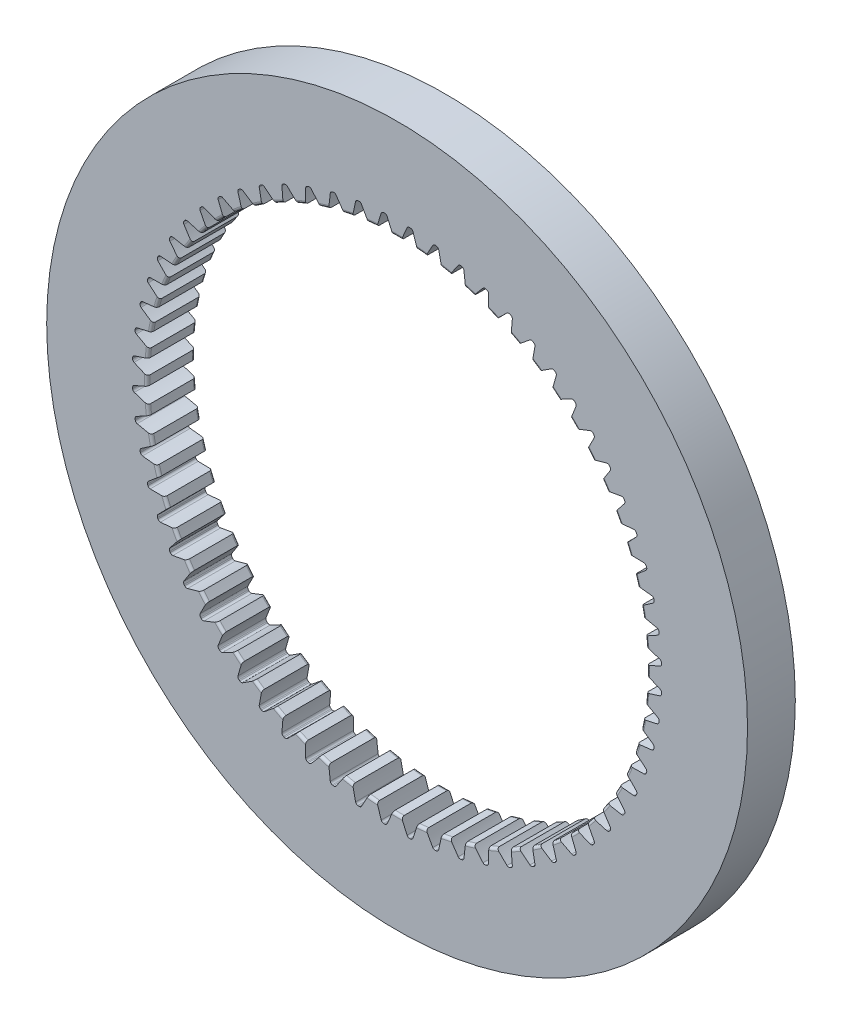
from build123d import *

# Parameters (mm, degrees)
BOSS_EXTRUDE1_DEPTH      = 2.38125
BOSS_EXTRUDE1_DEPTH_BACK = 2.38125
SKETCH3_R                = 34.925
SKETCH3_R_2              = 24.9047
FILLET1_R                = 0.266307122
CUT_EXTRUDE1_DEPTH       = 50.448777554
FILLET2_R                = 0.266307122
CIRPATTERN1_COUNT        = 64
FILLET2_OF_CIRPATTERN1_R = 0.266307122


with BuildPart() as part:
    # Sketch3 → Boss-Extrude1 (new, two sides: drawn at the far end of the back side and taken through both)
    with BuildSketch(Plane.XY.offset(-BOSS_EXTRUDE1_DEPTH_BACK)):
        Circle(SKETCH3_R)
        Circle(SKETCH3_R_2, mode=Mode.SUBTRACT)
    extrude(amount=BOSS_EXTRUDE1_DEPTH + BOSS_EXTRUDE1_DEPTH_BACK)

    # Fillet1
    fillet1_edges = [part.edges().sort_by_distance(p)[0] for p in [
        (-24.9047, 0, -2.38125),
        (-24.9047, 0, 2.38125),
    ]]
    fillet(fillet1_edges, radius=FILLET1_R)

    # Sketch4 → Cut-Extrude1 (cut, symmetric)
    with BuildSketch(Plane.XY):
        with BuildLine():
            ThreePointArc((26.370416202, -1.071779071), (26.360396954, -1.295003261), (26.34848816, -1.518134624))
            add(Edge.make_bspline(
                [(23.774707909, -2.110421825), (23.778625308, -2.110730183), (23.789623201, -2.111474), (23.810456777, -2.11240213), (23.844509879, -2.113237254), (23.887982397, -2.11330223), (23.944264107, -2.112238179), (24.01068022, -2.109507102), (24.083786477, -2.104956573), (24.163443966, -2.098332396), (24.243016436, -2.090242993), (24.322485107, -2.080793825), (24.401727413, -2.070135992), (24.497803738, -2.055753168), (24.613127869, -2.036458965), (24.748085996, -2.01091942), (24.901330211, -1.97842556), (25.057693383, -1.941530216), (25.211698065, -1.902118863), (25.367451313, -1.858721415), (25.518257814, -1.814197422), (25.675043137, -1.764278864), (25.819836388, -1.716335232), (25.982203741, -1.658550709), (26.113278607, -1.610730679), (26.248792879, -1.557933658), (26.314765264, -1.53173519), (26.34848816, -1.518134624)],
                knots=[0, 0, 0, 0, 0, 0.005376749, 0.015083688, 0.02853182, 0.04661014, 0.064854849, 0.092110526, 0.119476176, 0.146842496, 0.174208854, 0.201574956, 0.228941013, 0.256307345, 0.307035032, 0.361767352, 0.416499661, 0.471231937, 0.525964282, 0.580696616, 0.635428982, 0.690161387, 0.744893688, 0.799626082, 0.854358407, 0.909090914, 0.909090914, 0.909090914, 0.909090914, 0.909090914], degree=4))
            ThreePointArc((23.774707909, -2.110421825), (23.839442285, -1.1711567), (23.867083705, -0.230069314))
            add(Edge.make_bspline(
                [(23.867083705, -0.230069314), (23.871012464, -0.230146413), (23.882030306, -0.23048416), (23.902854535, -0.231602547), (23.936825519, -0.234109232), (23.980095074, -0.238305621), (24.036001477, -0.24488112), (24.101830085, -0.254108964), (24.174138286, -0.265803247), (24.25276292, -0.280203326), (24.331159327, -0.296053242), (24.409319153, -0.313246201), (24.487135235, -0.331619819), (24.581339164, -0.355350513), (24.694216815, -0.38585555), (24.826021768, -0.424500324), (24.975343115, -0.471858277), (25.127336981, -0.523902231), (25.276737099, -0.578218906), (25.427486659, -0.636673871), (25.573202871, -0.695765092), (25.724340355, -0.760810927), (25.86373709, -0.822715918), (26.019658726, -0.896136977), (26.145415248, -0.956574323), (26.275101968, -1.022399833), (26.33818878, -1.054938574), (26.370416202, -1.071779071)],
                knots=[0, 0, 0, 0, 0, 0.005376749, 0.015083688, 0.02853182, 0.04661014, 0.064854849, 0.092110526, 0.119476176, 0.146842496, 0.174208854, 0.201574956, 0.228941013, 0.256307345, 0.307035032, 0.361767352, 0.416499661, 0.471231937, 0.525964282, 0.580696616, 0.635428982, 0.690161387, 0.744893688, 0.799626082, 0.854358407, 0.909090914, 0.909090914, 0.909090914, 0.909090914, 0.909090914], degree=4))
        make_face()
    cut_extrude1 = extrude(amount=CUT_EXTRUDE1_DEPTH, both=True, mode=Mode.SUBTRACT)

    # Fillet2
    fillet2_edges = [part.edges().sort_by_distance(p)[0] for p in [
        (26.34848816, -1.518134624, 1.190625),
        (26.370416202, -1.071779071, 1.190625),
    ]]
    fillet(fillet2_edges, radius=FILLET2_R)

    # CirPattern1: Cut-Extrude1 ×64 about axis
    cirpattern1_axis = Axis((0, 0, 2.38125), (0, 0, -1))
    for i in range(1, CIRPATTERN1_COUNT):
        add(cut_extrude1.rotate(cirpattern1_axis, i * 360 / CIRPATTERN1_COUNT), mode=Mode.SUBTRACT)

    # Fillet2 of CirPattern1
    fillet2_of_cirpattern1_edges = [part.edges().sort_by_distance(p)[0] for p in [
        (26.072809773, -4.093427852, 1.190625),
        (26.13838272, -3.651370947, 1.190625),
        (25.546035975, -6.629299132, 1.190625),
        (25.654622325, -6.195798125, 1.190625),
        (24.773239886, -9.101326638, 1.190625),
        (24.923793892, -8.68055638, 1.190625),
        (23.761863955, -11.485703393, 1.190625),
        (23.952935699, -11.081716132, 1.190625),
        (22.521648284, -13.759466546, 1.190625),
        (22.751397641, -13.3761529, 1.190625),
        (21.064536828, -15.900718514, 1.190625),
        (21.330751187, -15.541770003, 1.190625),
        (19.404562368, -17.88883787, 1.190625),
        (19.704677939, -17.557711365, 1.190625),
        (17.557711365, -19.704677939, 1.190625),
        (17.88883787, -19.404562368, 1.190625),
        (15.541770003, -21.330751187, 1.190625),
        (15.900718514, -21.064536828, 1.190625),
        (13.3761529, -22.751397641, 1.190625),
        (13.759466545, -22.521648284, 1.190625),
        (11.081716132, -23.952935699, 1.190625),
        (11.485703393, -23.761863955, 1.190625),
        (8.68055638, -24.923793892, 1.190625),
        (9.101326638, -24.773239886, 1.190625),
        (6.195798125, -25.654622325, 1.190625),
        (6.629299132, -25.546035975, 1.190625),
        (3.651370947, -26.13838272, 1.190625),
        (4.093427852, -26.072809773, 1.190625),
        (1.071779071, -26.370416202, 1.190625),
        (1.518134624, -26.34848816, 1.190625),
        (-1.518134624, -26.34848816, 1.190625),
        (-1.071779071, -26.370416202, 1.190625),
        (-4.093427852, -26.072809773, 1.190625),
        (-3.651370947, -26.13838272, 1.190625),
        (-6.629299132, -25.546035975, 1.190625),
        (-6.195798125, -25.654622325, 1.190625),
        (-9.101326638, -24.773239886, 1.190625),
        (-8.68055638, -24.923793892, 1.190625),
        (-11.485703393, -23.761863955, 1.190625),
        (-11.081716132, -23.952935699, 1.190625),
        (-13.759466546, -22.521648284, 1.190625),
        (-13.3761529, -22.751397641, 1.190625),
        (-15.900718514, -21.064536828, 1.190625),
        (-15.541770003, -21.330751187, 1.190625),
        (-17.88883787, -19.404562368, 1.190625),
        (-17.557711365, -19.704677939, 1.190625),
        (-19.704677939, -17.557711365, 1.190625),
        (-19.404562368, -17.88883787, 1.190625),
        (-21.330751187, -15.541770003, 1.190625),
        (-21.064536828, -15.900718514, 1.190625),
        (-22.751397641, -13.3761529, 1.190625),
        (-22.521648284, -13.759466545, 1.190625),
        (-23.952935699, -11.081716132, 1.190625),
        (-23.761863955, -11.485703393, 1.190625),
        (-24.923793892, -8.68055638, 1.190625),
        (-24.773239886, -9.101326638, 1.190625),
        (-25.654622325, -6.195798125, 1.190625),
        (-25.546035975, -6.629299132, 1.190625),
        (-26.13838272, -3.651370947, 1.190625),
        (-26.072809773, -4.093427852, 1.190625),
        (-26.370416202, -1.071779071, 1.190625),
        (-26.34848816, -1.518134624, 1.190625),
        (-26.34848816, 1.518134624, 1.190625),
        (-26.370416202, 1.071779071, 1.190625),
        (-26.072809773, 4.093427852, 1.190625),
        (-26.13838272, 3.651370947, 1.190625),
        (-25.546035975, 6.629299132, 1.190625),
        (-25.654622325, 6.195798125, 1.190625),
        (-24.773239886, 9.101326638, 1.190625),
        (-24.923793892, 8.68055638, 1.190625),
        (-23.761863955, 11.485703393, 1.190625),
        (-23.952935699, 11.081716132, 1.190625),
        (-22.521648284, 13.759466546, 1.190625),
        (-22.751397641, 13.3761529, 1.190625),
        (-21.064536828, 15.900718514, 1.190625),
        (-21.330751187, 15.541770003, 1.190625),
        (-19.404562368, 17.88883787, 1.190625),
        (-19.704677939, 17.557711365, 1.190625),
        (-17.557711365, 19.704677939, 1.190625),
        (-17.88883787, 19.404562368, 1.190625),
        (-15.541770003, 21.330751187, 1.190625),
        (-15.900718514, 21.064536828, 1.190625),
        (-13.3761529, 22.751397641, 1.190625),
        (-13.759466545, 22.521648284, 1.190625),
        (-11.081716132, 23.952935699, 1.190625),
        (-11.485703393, 23.761863955, 1.190625),
        (-8.68055638, 24.923793892, 1.190625),
        (-9.101326638, 24.773239886, 1.190625),
        (-6.195798125, 25.654622325, 1.190625),
        (-6.629299132, 25.546035975, 1.190625),
        (-3.651370947, 26.13838272, 1.190625),
        (-4.093427852, 26.072809773, 1.190625),
        (-1.071779071, 26.370416202, 1.190625),
        (-1.518134624, 26.34848816, 1.190625),
        (1.518134624, 26.34848816, 1.190625),
        (1.071779071, 26.370416202, 1.190625),
        (4.093427852, 26.072809773, 1.190625),
        (3.651370947, 26.13838272, 1.190625),
        (6.629299132, 25.546035975, 1.190625),
        (6.195798125, 25.654622325, 1.190625),
        (9.101326638, 24.773239886, 1.190625),
        (8.68055638, 24.923793892, 1.190625),
        (11.485703393, 23.761863955, 1.190625),
        (11.081716132, 23.952935699, 1.190625),
        (13.759466546, 22.521648284, 1.190625),
        (13.3761529, 22.751397641, 1.190625),
        (15.900718514, 21.064536828, 1.190625),
        (15.541770003, 21.330751187, 1.190625),
        (17.88883787, 19.404562368, 1.190625),
        (17.557711365, 19.704677939, 1.190625),
        (19.704677939, 17.557711365, 1.190625),
        (19.404562368, 17.88883787, 1.190625),
        (21.330751187, 15.541770003, 1.190625),
        (21.064536828, 15.900718514, 1.190625),
        (22.751397641, 13.3761529, 1.190625),
        (22.521648284, 13.759466545, 1.190625),
        (23.952935699, 11.081716132, 1.190625),
        (23.761863955, 11.485703393, 1.190625),
        (24.923793892, 8.68055638, 1.190625),
        (24.773239886, 9.101326638, 1.190625),
        (25.654622325, 6.195798125, 1.190625),
        (25.546035975, 6.629299132, 1.190625),
        (26.13838272, 3.651370947, 1.190625),
        (26.072809773, 4.093427852, 1.190625),
        (26.370416202, 1.071779071, 1.190625),
        (26.34848816, 1.518134624, 1.190625),
    ]]
    fillet(fillet2_of_cirpattern1_edges, radius=FILLET2_OF_CIRPATTERN1_R)


solid = part.part
